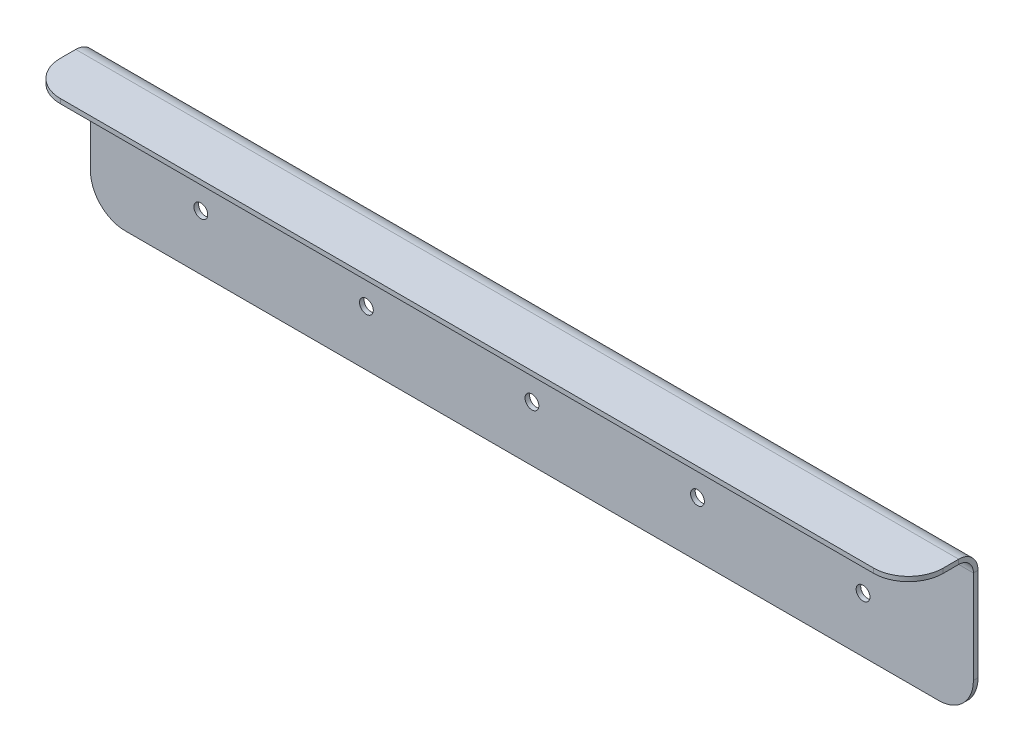
from build123d import *

# Parameters (mm, degrees)
SKETCH1_W                    = 304.8
SKETCH1_H                    = 1.5875
BASE_FLANGE1_DEPTH           = 50.8
EDGE_FLANGE1_STRIP_W         = 16.51
EDGE_FLANGE1_STRIP_H         = 1.5875
EDGE_FLANGE1_STRIP_CUT_DEPTH = 304.8
EDGE_FLANGE1_DEPTH           = 304.8
SKETCH10_R                   = 2.38125
CUT_EXTRUDE1_DEPTH           = 163.199630568
FILLET1_R                    = 12


# Sheet-metal steps are written as plain solids
with BuildPart() as part:
    # Sketch1 → Base-Flange1 (new body)
    with BuildSketch(Plane(origin=(0, 0, 0), x_dir=(1, 0, 0), z_dir=(0, 1, 0))):
        with Locations((0, -0.79375)):
            Rectangle(SKETCH1_W, SKETCH1_H)
    extrude(amount=BASE_FLANGE1_DEPTH)

    # Edge-Flange1 strip (across the edge) → Edge-Flange1 strip cut (cut)
    with BuildSketch(Plane(origin=(152.4, 50.8, 1.5875), x_dir=(0, -1, 0), z_dir=(-1, 0, 0))):
        with Locations((-1.5875, -0.79375)):
            Rectangle(EDGE_FLANGE1_STRIP_W, EDGE_FLANGE1_STRIP_H)
    extrude(amount=EDGE_FLANGE1_STRIP_CUT_DEPTH, mode=Mode.SUBTRACT)

    # Edge-Flange1 section (across the edge) → Edge-Flange1 (add)
    with BuildSketch(Plane(origin=(152.4, 50.8, 1.5875), x_dir=(0, -1, 0), z_dir=(-1, 0, 0))):
        with BuildLine():
            Line((0, 5.08), (0, 22.4125))
            Line((0, 22.4125), (1.5875, 22.4125))
            Line((1.5875, 22.4125), (1.5875, 5.08))
            ThreePointArc((1.5875, 5.08), (3.075397552, 1.487897552), (6.6675, 0))
            Line((6.6675, 0), (6.6675, -1.5875))
            ThreePointArc((6.6675, -1.5875), (1.952865536, 0.365365536), (0, 5.08))
        make_face()
    extrude(amount=EDGE_FLANGE1_DEPTH)

    # Sketch10 → Cut-Extrude1 (cut, through all)
    with BuildSketch(Plane.XY.offset(1.5875)):
        with Locations((-114.3, 19.05)):
            Circle(SKETCH10_R)
        with Locations((114.3, 19.05)):
            Circle(SKETCH10_R)
        with Locations((0, 19.05)):
            Circle(SKETCH10_R)
        with Locations((57.15, 19.05)):
            Circle(SKETCH10_R)
        with Locations((-57.15, 19.05)):
            Circle(SKETCH10_R)
    extrude(amount=-CUT_EXTRUDE1_DEPTH, mode=Mode.SUBTRACT)

    # Fillet1
    fillet1_edges = [part.edges().sort_by_distance(p)[0] for p in [
        (152.4, 50.00625, 24),
        (-152.4, 50.00625, 24),
        (-152.4, 0, 0.79375),
        (152.4, 0, 0.79375),
    ]]
    fillet(fillet1_edges, radius=FILLET1_R)


solid = part.part
